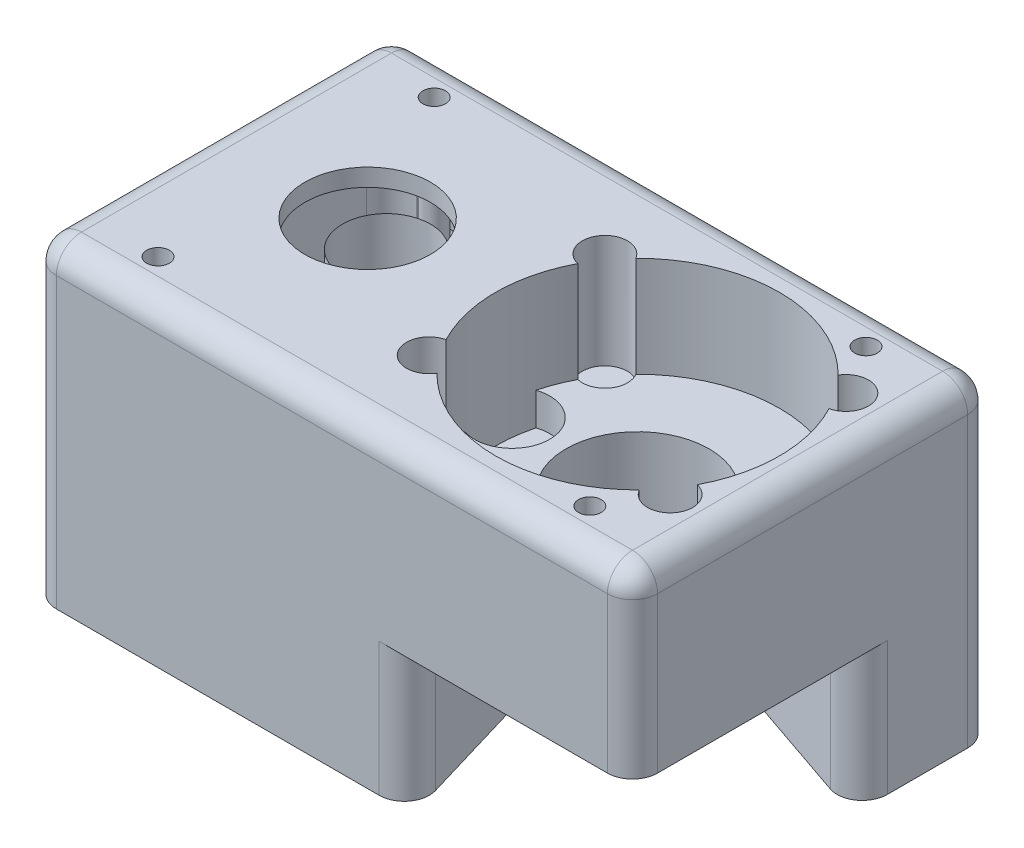
from build123d import *
from build123d.topology import SkipClean

# Parameters (mm, degrees)
SKETCH2_W           = 60.833
SKETCH2_H           = 36.449
BOSS_EXTRUDE1_DEPTH = 31.75
CAVITY1_START       = 21.59
CAVITY1_OUTLINE_R   = 4.445
CAVITY1_DEPTH       = 10.16
CAVITY1_START_2     = 16.256
CAVITY1_2_OUTLINE_R = 7.239
CAVITY1_2_DEPTH     = 5.334
CAVITY1_START_3     = 18.542
CAVITY1_3_OUTLINE_R = 4.445
CAVITY1_3_DEPTH     = 3.048
CAVITY1_START_4     = 29.972
CAVITY1_4_DEPTH     = 1.778
CAVITY1_START_5     = 20.32
CAVITY1_5_OUTLINE_R = 2.286
CAVITY1_5_DEPTH     = 1.27
CAVITY1_START_6     = 18.288
CAVITY1_6_DEPTH     = 0.254
CUT_EXTRUDE1_DEPTH  = 13.49375
SKETCH4_R           = 7.239
CUT_EXTRUDE2_DEPTH  = 40.007094336
SKETCH5_R           = 1.905
CUT_EXTRUDE3_DEPTH  = 12.7
FILLET1_R           = 2.54


# Read off the part's stored shape, not the designer's step: Cavity1
with BuildPart() as part:
    # Sketch2 → Boss-Extrude1 (new body)
    with BuildSketch(Plane(origin=(0, 0, 0), x_dir=(1, 0, 0), z_dir=(0, 1, 0))):
        Rectangle(SKETCH2_W, SKETCH2_H)
    extrude(amount=BOSS_EXTRUDE1_DEPTH)

    # Cavity1 outline → Cavity1 (cut)
    with BuildSketch(Plane(origin=(0, 0, 0), x_dir=(1, 0, 0), z_dir=(0, 1, 0)).offset(CAVITY1_START)):
        with BuildLine():
            ThreePointArc((-0.010188518, 6.663505747), (-1.651, 0), (-0.010188518, -6.663505747))
            ThreePointArc((-0.010188518, -6.663505747), (-1.339105214, -10.236847552), (2.469432496, -10.064128852))
            ThreePointArc((2.469432496, -10.064128852), (12.7, -14.351), (22.930567504, -10.064128852))
            ThreePointArc((22.930567504, -10.064128852), (26.739105214, -10.236847552), (25.410188518, -6.663505747))
            ThreePointArc((25.410188518, -6.663505747), (27.051, 0), (25.410188518, 6.663505747))
            ThreePointArc((25.410188518, 6.663505747), (26.739105214, 10.236847552), (22.930567504, 10.064128852))
            ThreePointArc((22.930567504, 10.064128852), (12.7, 14.351), (2.469432496, 10.064128852))
            ThreePointArc((2.469432496, 10.064128852), (-1.339105214, 10.236847552), (-0.010188518, 6.663505747))
        make_face()
        with Locations((-12.7, 0)):
            Circle(CAVITY1_OUTLINE_R)
    extrude(amount=CAVITY1_DEPTH, mode=Mode.SUBTRACT)

    # Cavity1 2 outline → Cavity1 2 (cut)
    with BuildSketch(Plane(origin=(0, 0, 0), x_dir=(1, 0, 0), z_dir=(0, 1, 0)).offset(CAVITY1_START_2)):
        with Locations((12.7, 0)):
            Circle(CAVITY1_2_OUTLINE_R)
    extrude(amount=CAVITY1_2_DEPTH, mode=Mode.SUBTRACT)

    # Cavity1 3 outline → Cavity1 3 (cut)
    with BuildSketch(Plane(origin=(0, 0, 0), x_dir=(1, 0, 0), z_dir=(0, 1, 0)).offset(CAVITY1_START_3)):
        with BuildLine():
            ThreePointArc((-1.186815, 3.62043784), (-1.651, 0), (-1.186815, -3.62043784))
            ThreePointArc((-1.186815, -3.62043784), (3.81, 0), (-1.186815, 3.62043784))
        make_face()
        with Locations((-12.7, 0)):
            Circle(CAVITY1_3_OUTLINE_R)
    extrude(amount=CAVITY1_3_DEPTH, mode=Mode.SUBTRACT)

    # Cavity1 4 outline → Cavity1 4 (cut)
    with BuildSketch(Plane(origin=(0, 0, 0), x_dir=(1, 0, 0), z_dir=(0, 1, 0)).offset(CAVITY1_START_4)):
        with BuildLine():
            Line((-8.432941907, -1.245086436), (-8.381648336, -1.261900971))
            ThreePointArc((-8.381648336, -1.261900971), (-8.34804351, -1.083049158), (-8.319577582, -0.903307825))
            Line((-8.319577582, -0.903307825), (-8.355488936, -0.939813075))
            ThreePointArc((-8.355488936, -0.939813075), (-8.391510846, -1.093135951), (-8.432941907, -1.245086436))
        make_face()
        with BuildLine():
            ThreePointArc((-13.598725967, -6.269761763), (-10.20766679, -4.581043619), (-8.381648336, -1.261900971))
            Line((-8.381648336, -1.261900971), (-8.432941907, -1.245086436))
            ThreePointArc((-8.432941907, -1.245086436), (-9.643662496, -3.227510815), (-11.689058668, -4.32851275))
            Line((-11.689058668, -4.32851275), (-13.598725967, -6.269761763))
        make_face()
        with BuildLine():
            Line((-8.432941907, 1.245086436), (-8.381648336, 1.261900971))
            ThreePointArc((-8.381648336, 1.261900971), (-10.20766679, 4.581043619), (-13.598725967, 6.269761763))
            Line((-13.598725967, 6.269761763), (-11.689058668, 4.32851275))
            ThreePointArc((-11.689058668, 4.32851275), (-9.643662496, 3.227510815), (-8.432941907, 1.245086436))
        make_face()
        with BuildLine():
            ThreePointArc((-8.319577582, 0.903307825), (-8.34804351, 1.083049158), (-8.381648336, 1.261900971))
            Line((-8.381648336, 1.261900971), (-8.432941907, 1.245086436))
            ThreePointArc((-8.432941907, 1.245086436), (-8.391510846, 1.093135951), (-8.355488936, 0.939813075))
            Line((-8.355488936, 0.939813075), (-8.319577582, 0.903307825))
        make_face()
        with BuildLine():
            ThreePointArc((-20.367669641, -2.667234262), (-17.588349777, -5.605544051), (-13.598725967, -6.269761763))
            Line((-13.598725967, -6.269761763), (-11.689058668, -4.32851275))
            ThreePointArc((-11.689058668, -4.32851275), (-14.8148806, -3.909642573), (-16.876068942, -1.522653339))
            Line((-16.876068942, -1.522653339), (-20.367669641, -2.667234262))
        make_face()
        with BuildLine():
            Line((-8.355488936, -0.939813075), (-8.319577582, -0.903307825))
            ThreePointArc((-8.319577582, -0.903307825), (-8.271164971, -0.452806607), (-8.255, 0))
            ThreePointArc((-8.255, 0), (-8.280193631, -0.472585083), (-8.355488936, -0.939813075))
        make_face()
        with BuildLine():
            ThreePointArc((-8.255, 0), (-8.271164971, 0.452806607), (-8.319577582, 0.903307825))
            Line((-8.319577582, 0.903307825), (-8.355488936, 0.939813075))
            ThreePointArc((-8.355488936, 0.939813075), (-8.280193631, 0.472585083), (-8.255, 0))
        make_face()
        with BuildLine():
            Line((-11.689058668, 4.32851275), (-13.598725967, 6.269761763))
            ThreePointArc((-13.598725967, 6.269761763), (-17.588349777, 5.605544051), (-20.367669641, 2.667234262))
            Line((-20.367669641, 2.667234262), (-16.876068942, 1.522653339))
            ThreePointArc((-16.876068942, 1.522653339), (-14.8148806, 3.909642573), (-11.689058668, 4.32851275))
        make_face()
        with BuildLine():
            ThreePointArc((-20.367669641, 2.667234262), (-20.955, 0), (-20.367669641, -2.667234262))
            Line((-20.367669641, -2.667234262), (-16.876068942, -1.522653339))
            ThreePointArc((-16.876068942, -1.522653339), (-17.145, 0), (-16.876068942, 1.522653339))
            Line((-16.876068942, 1.522653339), (-20.367669641, 2.667234262))
        make_face()
    extrude(amount=CAVITY1_4_DEPTH, mode=Mode.SUBTRACT)

    # Cavity1 5 outline → Cavity1 5 (cut)
    with BuildSketch(Plane(origin=(0, 0, 0), x_dir=(1, 0, 0), z_dir=(0, 1, 0)).offset(CAVITY1_START_5)):
        with Locations((0.508, -8.89)):
            Circle(CAVITY1_5_OUTLINE_R)
        with Locations((0.508, 8.89)):
            Circle(CAVITY1_5_OUTLINE_R)
        with Locations((24.892, -8.89)):
            Circle(CAVITY1_5_OUTLINE_R)
        with Locations((24.892, 8.89)):
            Circle(CAVITY1_5_OUTLINE_R)
    extrude(amount=CAVITY1_5_DEPTH, mode=Mode.SUBTRACT)

    # Cavity1 6 outline → Cavity1 6 (cut)
    with BuildSketch(Plane(origin=(0, 0, 0), x_dir=(1, 0, 0), z_dir=(0, 1, 0)).offset(CAVITY1_START_6)):
        with BuildLine():
            ThreePointArc((-1.186815, 3.62043784), (-1.651, 0), (-1.186815, -3.62043784))
            ThreePointArc((-1.186815, -3.62043784), (3.81, 0), (-1.186815, 3.62043784))
        make_face()
    extrude(amount=CAVITY1_6_DEPTH, mode=Mode.SUBTRACT)

    # Cavity1 7 outline → Cavity1 7 (revolve, cut)
    with BuildSketch(Plane(origin=(21.844, 0, -13.97), x_dir=(1, 0, 0), z_dir=(0, 0, 1))):
        with BuildLine():
            Line((0, 0), (1.905, 0))
            Line((1.905, 0), (1.905, 18.764885254))
            ThreePointArc((1.905, 18.764885254), (1.683631265, 19.314811386), (1.143, 19.558))
            Line((1.143, 19.558), (1.143, 31.75))
            Line((1.143, 31.75), (0, 31.75))
            Line((0, 31.75), (0, 0))
        make_face()
    revolve(axis=Axis((21.844, 0, -13.97), (0, 1, 0)), mode=Mode.SUBTRACT)

    # Cavity1 8 outline → Cavity1 8 (revolve, cut)
    with BuildSketch(Plane(origin=(21.844, 0, 13.97), x_dir=(1, 0, 0), z_dir=(0, 0, 1))):
        with BuildLine():
            Line((0, 0), (1.905, 0))
            Line((1.905, 0), (1.905, 18.764885254))
            ThreePointArc((1.905, 18.764885254), (1.683631265, 19.314811386), (1.143, 19.558))
            Line((1.143, 19.558), (1.143, 31.75))
            Line((1.143, 31.75), (0, 31.75))
            Line((0, 31.75), (0, 0))
        make_face()
    revolve(axis=Axis((21.844, 0, 13.97), (0, 1, 0)), mode=Mode.SUBTRACT)

    # Cavity1 9 outline → Cavity1 9 (revolve, cut)
    with BuildSketch(Plane(origin=(-21.844, 0, 13.97), x_dir=(1, 0, 0), z_dir=(0, 0, 1))):
        with BuildLine():
            Line((0, 0), (1.905, 0))
            Line((1.905, 0), (1.905, 18.764885254))
            ThreePointArc((1.905, 18.764885254), (1.683631265, 19.314811386), (1.143, 19.558))
            Line((1.143, 19.558), (1.143, 31.75))
            Line((1.143, 31.75), (0, 31.75))
            Line((0, 31.75), (0, 0))
        make_face()
    revolve(axis=Axis((-21.844, 0, 13.97), (0, 1, 0)), mode=Mode.SUBTRACT)

    # Cavity1 10 outline → Cavity1 10 (revolve, cut)
    with BuildSketch(Plane(origin=(-21.844, 0, -13.97), x_dir=(1, 0, 0), z_dir=(0, 0, 1))):
        with BuildLine():
            Line((0, 0), (1.905, 0))
            Line((1.905, 0), (1.905, 18.764885254))
            ThreePointArc((1.905, 18.764885254), (1.683631265, 19.314811386), (1.143, 19.558))
            Line((1.143, 19.558), (1.143, 31.75))
            Line((1.143, 31.75), (0, 31.75))
            Line((0, 31.75), (0, 0))
        make_face()
    revolve(axis=Axis((-21.844, 0, -13.97), (0, 1, 0)), mode=Mode.SUBTRACT)

    # Sketch3 → Cut-Extrude1 (cut)
    with BuildSketch(Plane.XZ):
        with BuildLine():
            Line((3.57162012, 2.719982678), (8.1915, 18.2245))
            Line((8.1915, 18.2245), (30.4165, 18.2245))
            Line((30.4165, 18.2245), (30.4165, -4.0005))
            Line((30.4165, -4.0005), (15.786188948, -9.011163231))
            ThreePointArc((15.786188948, -9.011163231), (6.102124289, -6.869764268), (3.57162012, 2.719982678))
        make_face()
    extrude(amount=-CUT_EXTRUDE1_DEPTH, mode=Mode.SUBTRACT)

    # Sketch4 → Cut-Extrude2 (cut, through all)
    with SkipClean():  # the faces are left unmerged after this step: merging them gives an invalid solid
        with BuildSketch(Plane(origin=(0, 16.256, 0), x_dir=(1, 0, 0), z_dir=(0, 1, 0))):
            with Locations(Location((12.7, 0, 0), (0, 0, 90))):
                Circle(SKETCH4_R)
        extrude(amount=-CUT_EXTRUDE2_DEPTH, mode=Mode.SUBTRACT)

    # Sketch5 → Cut-Extrude3 (cut)
    with SkipClean():  # the faces are left unmerged after this step: merging them gives an invalid solid
        with BuildSketch(Plane(origin=(0, 0, 0), x_dir=(1, 0, 0), z_dir=(0, 1, 0))):
            with Locations(Location((26.6065, 14.4145, 0), (0, 0, 270))):
                Circle(SKETCH5_R)
            with Locations(Location((-26.6065, -14.4145, 0), (0, 0, 270))):
                Circle(SKETCH5_R)
        extrude(amount=CUT_EXTRUDE3_DEPTH, mode=Mode.SUBTRACT)

    # Fillet1
    fillet1_edges = [part.edges().sort_by_distance(p)[0] for p in [
        (-30.4165, 31.75, 0),
        (0, 31.75, 18.2245),
        (30.4165, 6.746875, -4.0005),
        (8.1915, 6.746875, 18.2245),
        (30.4165, 31.75, 0),
        (30.4165, 22.621875, 18.2245),
        (-30.4165, 15.875, 18.2245),
        (-30.4165, 15.875, -18.2245),
        (30.4165, 15.875, -18.2245),
        (0, 31.75, -18.2245),
    ]]
    fillet(fillet1_edges, radius=FILLET1_R)


solid = part.part
